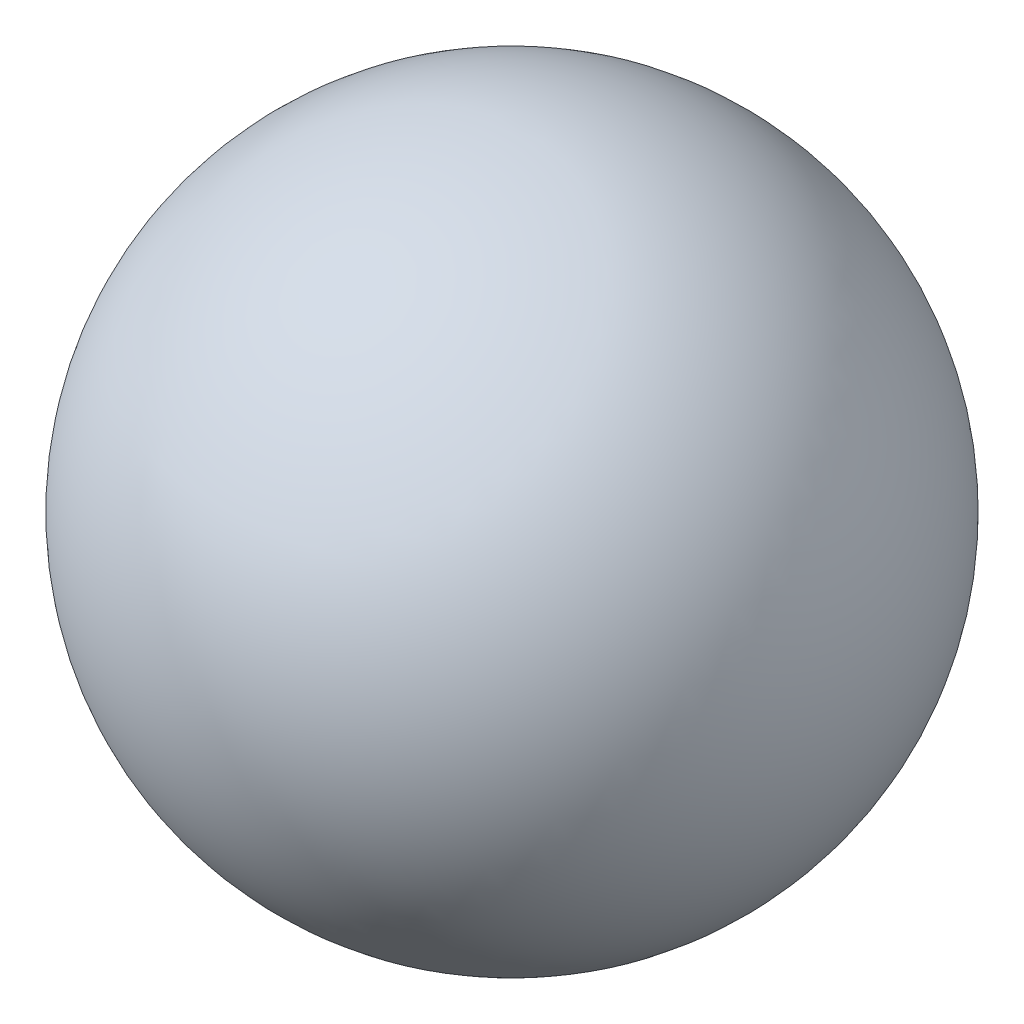
from build123d import *


with BuildPart() as part:
    # Sketch2 → Revolve2 (revolve)
    with BuildSketch(Plane.XY):
        with BuildLine():
            Line((0, 11), (0, -11))
            ThreePointArc((0, -11), (-11, 0), (0, 11))
        make_face()
    revolve(axis=Axis((0, -11, 0), (0, 1, 0)))


solid = part.part
